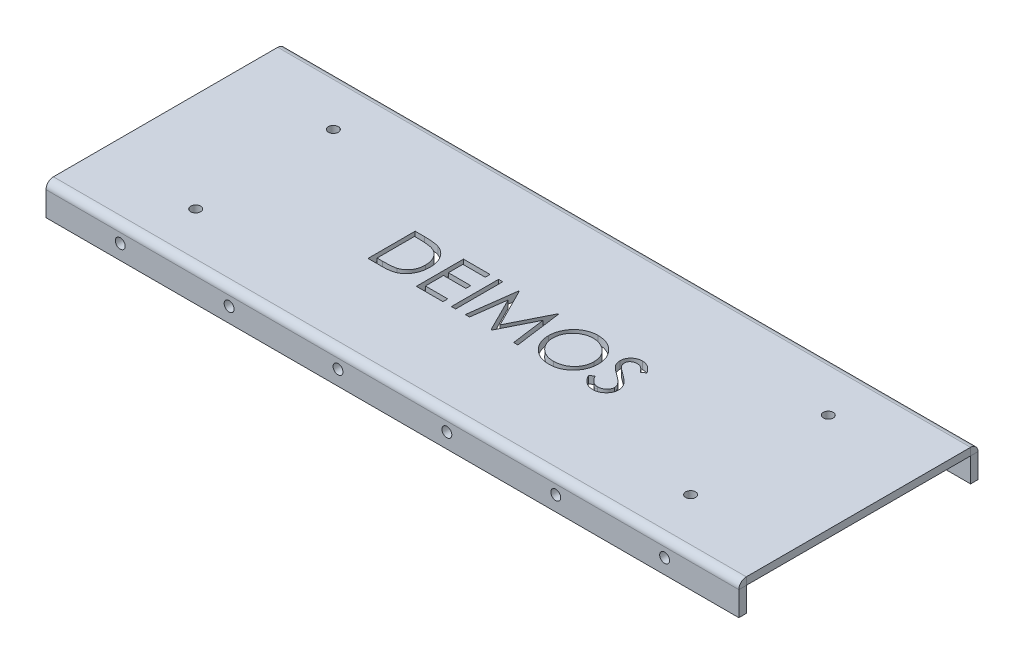
from build123d import *

# Parameters (mm, degrees)
SKETCH1_W                  = 280
SKETCH1_H                  = 115
BOSS_EXTRUDE1_DEPTH        = 3
SKETCH7_R                  = 2
CUT_EXTRUDE1_DEPTH         = 3
SKETCHED_BEND1_OUTLINE_W   = 280
SKETCHED_BEND1_OUTLINE_H   = 102.178097245
SKETCHED_BEND1_OUTLINE_R   = 2
SKETCHED_BEND1_DEPTH       = 3
SKETCHED_START             = 3
SKETCHED_BEND1_2_OUTLINE_W = 280
SKETCHED_BEND1_2_OUTLINE_H = 3
SKETCHED_BEND1_2_DEPTH     = 90.64380551
SKETCHED_START_2           = 93.64380551
SKETCHED_BEND1_3_OUTLINE_W = 280
SKETCHED_BEND1_3_OUTLINE_H = 9.821902755
SKETCHED_BEND1_3_OUTLINE_R = 2
SKETCHED_BEND1_3_DEPTH     = 3
SKETCHED_BEND1_4_DEPTH     = 280
SKETCHED_BEND1_5_DEPTH     = 280
SKETCH8_R                  = 2
SKETCH8_W                  = 1.709615384
SKETCH8_H                  = 19.05
CUT_EXTRUDE2_DEPTH         = 3


with BuildPart() as part:
    # Sketch1 → Boss-Extrude1 (new body)
    with BuildSketch(Plane.XY):
        with Locations((140, -57.5)):
            Rectangle(SKETCH1_W, SKETCH1_H)
    extrude(amount=BOSS_EXTRUDE1_DEPTH)

    # Sketch7 → Cut-Extrude1 (cut)
    with BuildSketch(Plane.XY.offset(3)):
        with Locations((30, -6)):
            Circle(SKETCH7_R)
        with Locations((74, -6)):
            Circle(SKETCH7_R)
        with Locations((118, -6)):
            Circle(SKETCH7_R)
        with Locations((162, -6)):
            Circle(SKETCH7_R)
        with Locations((206, -6)):
            Circle(SKETCH7_R)
        with Locations((250, -6)):
            Circle(SKETCH7_R)
        with Locations(Location((250, -109, 0), (0, 0, 180))):
            Circle(SKETCH7_R)
        with Locations(Location((206, -109, 0), (0, 0, 180))):
            Circle(SKETCH7_R)
        with Locations(Location((162, -109, 0), (0, 0, 180))):
            Circle(SKETCH7_R)
        with Locations(Location((118, -109, 0), (0, 0, 180))):
            Circle(SKETCH7_R)
        with Locations(Location((74, -109, 0), (0, 0, 180))):
            Circle(SKETCH7_R)
        with Locations(Location((30, -109, 0), (0, 0, 180))):
            Circle(SKETCH7_R)
    extrude(amount=-CUT_EXTRUDE1_DEPTH, mode=Mode.SUBTRACT)

    # Sketched Bend1: read off the stored shape, not the designer's step
    # Sketched Bend1 outline → Sketched Bend1 (cut)
    with BuildSketch(Plane.XY):
        with Locations((140, -51.089048623)):
            Rectangle(SKETCHED_BEND1_OUTLINE_W, SKETCHED_BEND1_OUTLINE_H)
        with Locations((30, -6)):
            Circle(SKETCHED_BEND1_OUTLINE_R, mode=Mode.SUBTRACT)
        with Locations((74, -6)):
            Circle(SKETCHED_BEND1_OUTLINE_R, mode=Mode.SUBTRACT)
        with Locations((118, -6)):
            Circle(SKETCHED_BEND1_OUTLINE_R, mode=Mode.SUBTRACT)
        with Locations((162, -6)):
            Circle(SKETCHED_BEND1_OUTLINE_R, mode=Mode.SUBTRACT)
        with Locations((206, -6)):
            Circle(SKETCHED_BEND1_OUTLINE_R, mode=Mode.SUBTRACT)
        with Locations((250, -6)):
            Circle(SKETCHED_BEND1_OUTLINE_R, mode=Mode.SUBTRACT)
    extrude(amount=SKETCHED_BEND1_DEPTH, mode=Mode.SUBTRACT)

    # Sketched Bend1 2 outline → Sketched Bend1 2 (add)
    with BuildSketch(Plane.XY.offset(SKETCHED_START)):
        with Locations((140, -103.678097245)):
            Rectangle(SKETCHED_BEND1_2_OUTLINE_W, SKETCHED_BEND1_2_OUTLINE_H)
    extrude(amount=SKETCHED_BEND1_2_DEPTH)

    # Sketched Bend1 3 outline → Sketched Bend1 3 (add)
    with BuildSketch(Plane.XY.offset(SKETCHED_START_2)):
        with Locations((140, -110.089048623)):
            Rectangle(SKETCHED_BEND1_3_OUTLINE_W, SKETCHED_BEND1_3_OUTLINE_H)
        with Locations((30, -109)):
            Circle(SKETCHED_BEND1_3_OUTLINE_R, mode=Mode.SUBTRACT)
        with Locations((74, -109)):
            Circle(SKETCHED_BEND1_3_OUTLINE_R, mode=Mode.SUBTRACT)
        with Locations((118, -109)):
            Circle(SKETCHED_BEND1_3_OUTLINE_R, mode=Mode.SUBTRACT)
        with Locations((162, -109)):
            Circle(SKETCHED_BEND1_3_OUTLINE_R, mode=Mode.SUBTRACT)
        with Locations((206, -109)):
            Circle(SKETCHED_BEND1_3_OUTLINE_R, mode=Mode.SUBTRACT)
        with Locations((250, -109)):
            Circle(SKETCHED_BEND1_3_OUTLINE_R, mode=Mode.SUBTRACT)
    extrude(amount=SKETCHED_BEND1_3_DEPTH)

    # Sketched Bend1 4 outline → Sketched Bend1 4 (cut)
    with BuildSketch(Plane.YZ):
        with BuildLine():
            Line((-102.178097245, 0), (-102.178097245, 3))
            ThreePointArc((-102.178097245, 3), (-103.056776902, 0.878679656), (-105.178097245, 0))
            Line((-105.178097245, 0), (-102.178097245, 0))
        make_face()
    extrude(amount=SKETCHED_BEND1_4_DEPTH, mode=Mode.SUBTRACT)

    # Sketched Bend1 5 outline → Sketched Bend1 5 (add)
    with BuildSketch(Plane.YZ):
        with BuildLine():
            ThreePointArc((-102.178097245, 93.64380551), (-103.056776902, 95.765125853), (-105.178097245, 96.64380551))
            Line((-105.178097245, 96.64380551), (-105.178097245, 93.64380551))
            Line((-105.178097245, 93.64380551), (-102.178097245, 93.64380551))
        make_face()
    extrude(amount=SKETCHED_BEND1_5_DEPTH)

    # Sketch8 → Cut-Extrude2 (cut)
    # profile 1 of 10: a face of its own
    with BuildSketch(Plane(origin=(0, -102.178097245, 0), x_dir=(1, 0, 0), z_dir=(0, 1, 0))):
        with Locations(Location((40, -20.5, 0), (0, 0, 270))):
            Circle(SKETCH8_R)
    # profile 2 of 10: a face of its own
    with BuildSketch(Plane(origin=(0, -102.178097245, 0), x_dir=(1, 0, 0), z_dir=(0, 1, 0))):
        with Locations(Location((240, -20.5, 0), (0, 0, 90))):
            Circle(SKETCH8_R)
    # profile 3 of 10: a face of its own
    with BuildSketch(Plane(origin=(0, -102.178097245, 0), x_dir=(1, 0, 0), z_dir=(0, 1, 0))):
        with Locations(Location((240, -76.14380551, 0), (0, 0, 270))):
            Circle(SKETCH8_R)
    # profile 4 of 10: a face of its own
    with BuildSketch(Plane(origin=(0, -102.178097245, 0), x_dir=(1, 0, 0), z_dir=(0, 1, 0))):
        with Locations(Location((40, -76.14380551, 0), (0, 0, 90))):
            Circle(SKETCH8_R)
    # profile 5 of 10: a face of its own
    with BuildSketch(Plane(origin=(0, -102.178097245, 0), x_dir=(1, 0, 0), z_dir=(0, 1, 0))):
        with BuildLine():
            Line((92.130769231, -58.64380551), (92.130769231, -39.59380551))
            Line((92.130769231, -39.59380551), (95.977403846, -39.59380551))
            add(Edge.make_bspline(
                [(95.977403846, -39.59380551), (96.311970768, -39.596214355), (96.958352319, -39.600868232), (97.892414354, -39.630376089), (98.75665169, -39.682575625), (99.548221966, -39.75860976), (100.269298277, -39.851971271), (100.917861558, -39.968994901), (101.497265365, -40.107179085), (101.853606177, -40.224992179), (102.022115385, -40.280704548)],
                knots=[0, 0, 0, 0, 1.314313732, 2.53924729, 3.670748893, 4.714932338, 5.66265055, 6.526160246, 7.303039223, 8, 8, 8, 8], degree=3))
            add(Edge.make_bspline(
                [(102.022115385, -40.280704548), (102.242522466, -40.364691675), (102.678338527, -40.530761378), (103.298863008, -40.844032104), (103.883019626, -41.198977701), (104.433940972, -41.596066039), (104.939042613, -42.046540564), (105.418057022, -42.531265559), (105.85138859, -43.067867811), (106.24821803, -43.645218817), (106.606007834, -44.256517272), (106.917008107, -44.900598364), (107.175293414, -45.574191168), (107.389705119, -46.275422473), (107.558686552, -47.005834187), (107.67397678, -47.766276801), (107.750018882, -48.55374496), (107.757660933, -49.088094541), (107.761538462, -49.359220173)],
                knots=[0, 0, 0, 0, 0.984719456, 1.947108742, 2.898477687, 3.838006223, 4.779231079, 5.722358779, 6.681677486, 7.655904652, 8.64651281, 9.637519902, 10.640069247, 11.656948941, 12.698408672, 13.768548281, 14.867775369, 16, 16, 16, 16], degree=3))
            add(Edge.make_bspline(
                [(107.761538462, -49.359220173), (107.758115081, -49.594684914), (107.751368953, -50.05869278), (107.690793677, -50.742538226), (107.602748278, -51.406096378), (107.466436287, -52.046207403), (107.300959749, -52.66847956), (107.08888344, -53.266280776), (106.845938811, -53.845094938), (106.562638758, -54.397095771), (106.251626362, -54.920063841), (105.917860874, -55.413053501), (105.561698289, -55.869030065), (105.179742344, -56.289374368), (104.776928916, -56.67345273), (104.350620774, -57.024473557), (103.899717884, -57.33556852), (103.426239807, -57.618962352), (102.916374018, -57.866178858), (102.360463089, -58.075347911), (101.756136249, -58.248684489), (101.104876855, -58.393306079), (100.40555964, -58.508026827), (99.657498983, -58.584914763), (98.861844221, -58.63691001), (98.31549422, -58.64146238), (98.034284856, -58.64380551)],
                knots=[0, 0, 0, 0, 1.105936401, 2.179363191, 3.223086493, 4.248585256, 5.251745608, 6.245858792, 7.225916811, 8.198733463, 9.158002045, 10.082870192, 10.993790845, 11.873723703, 12.748670949, 13.606408763, 14.465103618, 15.319838547, 16.196477973, 17.123216899, 18.106603292, 19.147568657, 20.255746949, 21.433717677, 22.679120308, 24, 24, 24, 24], degree=3))
            Line((98.034284856, -58.64380551), (92.130769231, -58.64380551))
        make_face()
        with BuildLine():
            Line((93.840384615, -56.689959356), (96.027013221, -56.689959356))
            add(Edge.make_bspline(
                [(96.027013221, -56.689959356), (96.341220496, -56.688609003), (96.945556156, -56.686011779), (97.814551827, -56.663221431), (98.608552542, -56.625981742), (99.327671043, -56.573865962), (99.971501304, -56.504912499), (100.541388857, -56.428032671), (101.03546562, -56.332252261), (101.334438698, -56.245433467), (101.472596154, -56.205313923)],
                knots=[0, 0, 0, 0, 1.375205317, 2.645023457, 3.804390687, 4.853969522, 5.800190428, 6.637939096, 7.370582563, 8, 8, 8, 8], degree=3))
            add(Edge.make_bspline(
                [(101.472596154, -56.205313923), (101.646486525, -56.144073299), (101.990113898, -56.023054782), (102.484766662, -55.802305226), (102.94608693, -55.540819103), (103.382114353, -55.250158155), (103.786663721, -54.92007063), (104.164529268, -54.557734248), (104.514950216, -54.161304972), (104.834306092, -53.731274836), (105.12010129, -53.270320377), (105.367594695, -52.782973296), (105.584500889, -52.274573372), (105.7547458, -51.737313523), (105.888180622, -51.17599679), (105.982694138, -50.590583687), (106.041557139, -49.981183538), (106.04842302, -49.566698405), (106.051923077, -49.355404068)],
                knots=[0, 0, 0, 0, 0.998632004, 1.973411704, 2.929992603, 3.868527914, 4.809262121, 5.754881198, 6.702106254, 7.672490631, 8.653608572, 9.636854334, 10.631411391, 11.644891563, 12.686317036, 13.754757253, 14.855430412, 16, 16, 16, 16], degree=3))
            add(Edge.make_bspline(
                [(106.051923077, -49.355404068), (106.049129327, -49.132608982), (106.043640981, -48.694926064), (105.97465652, -48.052719566), (105.873846339, -47.435060596), (105.728066562, -46.841907847), (105.542297065, -46.272104102), (105.310460515, -45.728800768), (105.045575058, -45.206259981), (104.730415468, -44.716542362), (104.385253452, -44.253392725), (104.002196709, -43.829095256), (103.587331042, -43.442683422), (103.145181362, -43.088139449), (102.663286579, -42.779727156), (102.152998633, -42.503846791), (101.60683148, -42.26971744), (101.22685095, -42.145191058), (101.03374399, -42.081906471)],
                knots=[0, 0, 0, 0, 1.122418816, 2.205001699, 3.251619955, 4.274784885, 5.280384055, 6.268708349, 7.249350384, 8.229342522, 9.199999885, 10.157847722, 11.105861043, 12.055065948, 13.010012805, 13.98527497, 14.976112212, 16, 16, 16, 16], degree=3))
            add(Edge.make_bspline(
                [(101.03374399, -42.081906471), (100.873989894, -42.037729914), (100.534308852, -41.943798432), (99.980011198, -41.841334619), (99.356177313, -41.750958703), (98.660037512, -41.674442803), (97.892385327, -41.619538954), (97.052630368, -41.57832937), (96.140409663, -41.550534699), (95.508044729, -41.548636735), (95.17983774, -41.547651664)],
                knots=[0, 0, 0, 0, 0.674548936, 1.434276114, 2.292660221, 3.240891867, 4.284742987, 5.42552168, 6.663806718, 8, 8, 8, 8], degree=3))
            Line((95.17983774, -41.547651664), (93.840384615, -41.547651664))
            Line((93.840384615, -41.547651664), (93.840384615, -56.689959356))
        make_face(mode=Mode.SUBTRACT)
    # profile 6 of 10: a face of its own
    with BuildSketch(Plane(origin=(0, -102.178097245, 0), x_dir=(1, 0, 0), z_dir=(0, 1, 0))):
        Polygon((111.669230769, -39.59380551), (122.415384615, -39.59380551), (122.415384615, -41.547651664), (113.378846154, -41.547651664), (113.378846154, -47.409190125), (122.415384615, -47.409190125), (122.415384615, -49.363036279), (113.378846154, -49.363036279), (113.378846154, -56.689959356), (122.415384615, -56.689959356), (122.415384615, -58.64380551), (111.669230769, -58.64380551), align=None)
    # profile 7 of 10: a face of its own
    with BuildSketch(Plane(origin=(0, -102.178097245, 0), x_dir=(1, 0, 0), z_dir=(0, 1, 0))):
        with Locations((126.689423077, -49.11880551)):
            Rectangle(SKETCH8_W, SKETCH8_H)
    # profile 8 of 10: a face of its own
    with BuildSketch(Plane(origin=(0, -102.178097245, 0), x_dir=(1, 0, 0), z_dir=(0, 1, 0))):
        Polygon((131.451923077, -58.64380551), (133.966736779, -39.59380551), (134.210967548, -39.59380551), (142.075961538, -55.224574741), (149.918058894, -39.59380551), (150.162289663, -39.59380551), (152.7, -58.64380551), (150.990384615, -58.64380551), (149.158653846, -44.947801904), (142.285847356, -58.64380551), (141.896604567, -58.64380551), (134.993269231, -44.905824741), (133.172986779, -58.64380551), align=None)
    # profile 9 of 10: a face of its own
    with BuildSketch(Plane(origin=(0, -102.178097245, 0), x_dir=(1, 0, 0), z_dir=(0, 1, 0))):
        with BuildLine():
            add(Edge.make_bspline(
                [(165.522115385, -39.105343971), (165.874856647, -39.114278309), (166.567669588, -39.131826085), (167.585891532, -39.266150921), (168.557959122, -39.498535829), (169.491790877, -39.808032919), (170.376216935, -40.220897502), (171.217894336, -40.719926667), (172.014820463, -41.310348535), (172.756253983, -41.987599041), (173.434743955, -42.724471841), (174.032510565, -43.510844465), (174.533483621, -44.341962232), (174.944886262, -45.21532761), (175.267640124, -46.128965436), (175.490356633, -47.087746508), (175.63262285, -48.085458636), (175.64925501, -48.765961999), (175.657692308, -49.111173298)],
                knots=[0, 0, 0, 0, 1.065120563, 2.091984664, 3.0946048, 4.079830382, 5.057816894, 6.036188127, 7.030412546, 8.04752943, 9.064399622, 10.05169764, 11.02544977, 11.989514704, 12.962713494, 13.945757189, 14.957906945, 16, 16, 16, 16], degree=3))
            add(Edge.make_bspline(
                [(175.657692308, -49.111173298), (175.649256246, -49.453841685), (175.632627792, -50.129280773), (175.490194874, -51.120661519), (175.266814575, -52.073655167), (174.947883469, -52.986670792), (174.538441936, -53.860671532), (174.034133076, -54.693357666), (173.440093057, -55.485002179), (172.764052911, -56.226932543), (172.027084382, -56.907275919), (171.236616787, -57.500105799), (170.410427432, -58.01023282), (169.537884592, -58.417269674), (168.630560106, -58.742599698), (167.680333461, -58.964410442), (166.691657217, -59.107487063), (166.017445039, -59.123916414), (165.674759615, -59.132267048)],
                knots=[0, 0, 0, 0, 1.043624062, 2.057103931, 3.04512605, 4.022047818, 4.998200453, 5.980619268, 6.982898556, 8.009068085, 9.034988726, 10.034168286, 11.015286542, 11.987931943, 12.962482838, 13.94673481, 14.956375938, 16, 16, 16, 16], degree=3))
            add(Edge.make_bspline(
                [(165.674759615, -59.132267048), (165.329550108, -59.123833957), (164.649050275, -59.107210089), (163.650084411, -58.964708443), (162.690629834, -58.741870775), (161.773430294, -58.423412272), (160.89797432, -58.011838488), (160.062549727, -57.509983225), (159.270509797, -56.914495785), (158.528421148, -56.238674858), (157.849429084, -55.50295541), (157.257467339, -54.71464325), (156.755499222, -53.889204265), (156.34530737, -53.024347741), (156.020562241, -52.124254603), (155.799011731, -51.182920747), (155.655668906, -50.205712865), (155.63915067, -49.540362233), (155.630769231, -49.202759837)],
                knots=[0, 0, 0, 0, 1.053102029, 2.075944431, 3.073151272, 4.055350789, 5.033113405, 6.020478099, 7.024410459, 8.052272461, 9.079885166, 10.07527673, 11.055994387, 12.023226415, 12.992069828, 13.970394897, 14.97016774, 16, 16, 16, 16], degree=3))
            add(Edge.make_bspline(
                [(155.630769231, -49.202759837), (155.633679175, -48.976159166), (155.639462355, -48.525816494), (155.709085709, -47.857071142), (155.810114397, -47.199080562), (155.954904807, -46.55371583), (156.14427088, -45.922556757), (156.367711201, -45.301250462), (156.640615216, -44.696093337), (156.949119886, -44.10421859), (157.29344487, -43.534852703), (157.673768592, -42.996665258), (158.076732526, -42.485140118), (158.518493283, -42.013532854), (158.984491363, -41.568123953), (159.48228625, -41.155758307), (160.008840465, -40.772717503), (160.566419704, -40.427529646), (161.141284886, -40.115332071), (161.733885633, -39.847424568), (162.336173544, -39.61748529), (162.950969556, -39.43111737), (163.576641073, -39.28398586), (164.214553643, -39.183797263), (164.864199063, -39.113996333), (165.301866385, -39.108240501), (165.522115385, -39.105343971)],
                knots=[0, 0, 0, 0, 1.037015668, 2.060948919, 3.074880161, 4.083647147, 5.086022904, 6.090072063, 7.104153813, 8.122640571, 9.144368836, 10.147691507, 11.138137339, 12.123020368, 13.103399296, 14.087645067, 15.080126199, 16.082011238, 17.087798457, 18.072939717, 19.057185487, 20.037253025, 21.01195951, 21.997135196, 22.992090687, 24, 24, 24, 24], degree=3))
        make_face()
        with BuildLine():
            add(Edge.make_bspline(
                [(165.606069712, -41.059190125), (165.425287206, -41.061393885), (165.065450488, -41.065780337), (164.530501798, -41.12356016), (164.002588558, -41.205909984), (163.481601744, -41.323375119), (162.969721226, -41.483417177), (162.462175662, -41.667608406), (161.963593326, -41.891968913), (161.475620185, -42.14545749), (161.002553848, -42.426030902), (160.55617043, -42.736120091), (160.135314325, -43.068453079), (159.741015974, -43.423805451), (159.374433165, -43.803986855), (159.028350719, -44.203233686), (158.716640567, -44.63295755), (158.43096907, -45.081505622), (158.175329825, -45.548293657), (157.948006966, -46.028407336), (157.762057147, -46.525763031), (157.610406213, -47.034964946), (157.484677243, -47.555206619), (157.405026884, -48.090434596), (157.346612185, -48.63795942), (157.342476455, -49.00797494), (157.340384615, -49.195127625)],
                knots=[0, 0, 0, 0, 1.008559885, 2.007477868, 2.99961109, 3.989939068, 4.984837346, 5.991145699, 7.001802488, 8.033829008, 9.059044045, 10.069351652, 11.065060232, 12.050310815, 13.029377138, 14.011219647, 14.996725999, 15.989392538, 16.977580475, 17.965360261, 18.951710183, 19.937753436, 20.929683414, 21.935841486, 22.955955122, 24, 24, 24, 24], degree=3))
            add(Edge.make_bspline(
                [(157.340384615, -49.195127625), (157.347323507, -49.47033057), (157.360974453, -50.011739899), (157.48048637, -50.805135082), (157.664574546, -51.567615612), (157.935941069, -52.295009433), (158.275306557, -52.993569029), (158.694552917, -53.657097427), (159.191263083, -54.285773958), (159.755488849, -54.875209636), (160.372288152, -55.413213228), (161.027242011, -55.885454066), (161.713333789, -56.285015569), (162.432352649, -56.610526034), (163.180459969, -56.868461607), (163.962476354, -57.045238157), (164.773192426, -57.161581707), (165.325809278, -57.172754564), (165.606069712, -57.178420894)],
                knots=[0, 0, 0, 0, 1.032063989, 2.030389145, 3.003944642, 3.970395727, 4.937377036, 5.913328081, 6.909231446, 7.93887556, 8.970685674, 9.976071282, 10.964166581, 11.944589148, 12.933237628, 13.927779006, 14.949070134, 16, 16, 16, 16], degree=3))
            add(Edge.make_bspline(
                [(165.606069712, -57.178420894), (165.794444285, -57.175832792), (166.16804764, -57.170699808), (166.723738983, -57.118999867), (167.269419221, -57.036094978), (167.804322973, -56.916729552), (168.327843161, -56.767338328), (168.842164875, -56.589859123), (169.341809855, -56.368437143), (169.833081258, -56.123791864), (170.303323659, -55.844899007), (170.752226199, -55.545334221), (171.168474032, -55.213490728), (171.562477407, -54.863418062), (171.930565257, -54.488057691), (172.270248442, -54.087897626), (172.580383162, -53.660412049), (172.865946181, -53.21254434), (173.120689654, -52.744479022), (173.342644464, -52.262624632), (173.530946181, -51.76816768), (173.682957043, -51.260394984), (173.802076484, -50.740270935), (173.884154334, -50.20709911), (173.941567979, -49.661946117), (173.94589547, -49.293225987), (173.948076923, -49.107357193)],
                knots=[0, 0, 0, 0, 1.047197238, 2.076906641, 3.100256066, 4.114471768, 5.12198147, 6.126382909, 7.136867548, 8.15857795, 9.17633901, 10.174870724, 11.156907918, 12.133735059, 13.104061851, 14.077631395, 15.04955518, 16.038496417, 17.029181396, 18.010275684, 18.986308667, 19.968651475, 20.955262928, 21.950658345, 22.966943676, 24, 24, 24, 24], degree=3))
            add(Edge.make_bspline(
                [(173.948076923, -49.107357193), (173.945893722, -48.922759948), (173.941562942, -48.556577309), (173.884181759, -48.015226283), (173.801989769, -47.485890947), (173.683538459, -46.97064939), (173.530865479, -46.469370275), (173.342611581, -45.982524406), (173.120623022, -45.508298087), (172.865852544, -45.047863413), (172.579472133, -44.606040911), (172.26653918, -44.183662065), (171.921650642, -43.788659002), (171.554660421, -43.411280167), (171.156401746, -43.059574225), (170.728678659, -42.733424506), (170.276683784, -42.42495997), (169.798108403, -42.14669084), (169.304202026, -41.889710517), (168.797396055, -41.669541485), (168.283431956, -41.48245895), (167.763616716, -41.322890897), (167.233575077, -41.206370047), (166.696888522, -41.123485947), (166.154299572, -41.065800447), (165.789392905, -41.061400558), (165.606069712, -41.059190125)],
                knots=[0, 0, 0, 0, 1.02996197, 2.043119294, 3.035359645, 4.018872909, 4.991431989, 5.957985074, 6.929999688, 7.912076566, 8.892894881, 9.867085534, 10.843653904, 11.817741046, 12.803660682, 13.806313499, 14.818574707, 15.856120519, 16.894564902, 17.924820532, 18.937903209, 19.946497019, 20.957711757, 21.963978472, 22.977135795, 24, 24, 24, 24], degree=3))
        make_face(mode=Mode.SUBTRACT)
    # profile 10 of 10: a face of its own
    with BuildSketch(Plane(origin=(0, -102.178097245, 0), x_dir=(1, 0, 0), z_dir=(0, 1, 0))):
        with BuildLine():
            Line((177.611538462, -54.968895654), (179.221935096, -54.003420894))
            add(Edge.make_bspline(
                [(179.221935096, -54.003420894), (179.37171293, -54.254142761), (179.658681481, -54.734516182), (180.137388164, -55.383620659), (180.63341158, -55.935320398), (181.150424953, -56.386405934), (181.685272471, -56.741546303), (182.241445677, -56.99301845), (182.817070333, -57.149859687), (183.208813561, -57.168910158), (183.404387019, -57.178420894)],
                knots=[0, 0, 0, 0, 1.272034388, 2.437168799, 3.508375237, 4.49857839, 5.41946034, 6.295179144, 7.148887113, 8, 8, 8, 8], degree=3))
            add(Edge.make_bspline(
                [(183.404387019, -57.178420894), (183.571411217, -57.173769034), (183.902537082, -57.16454671), (184.390011576, -57.07593263), (184.863441099, -56.939795186), (185.313068113, -56.744826973), (185.73268853, -56.508941786), (186.100662114, -56.22402902), (186.418775959, -55.905043815), (186.67899414, -55.549175366), (186.878638332, -55.166449171), (187.032083733, -54.773605779), (187.117237633, -54.364474), (187.130065106, -54.089008481), (187.136538462, -53.949995414)],
                knots=[0, 0, 0, 0, 1.095163259, 2.171163733, 3.241058638, 4.321873601, 5.38011039, 6.391990106, 7.366004449, 8.327778327, 9.272591725, 10.192022065, 11.087607919, 12, 12, 12, 12], degree=3))
            add(Edge.make_bspline(
                [(187.136538462, -53.949995414), (187.128513999, -53.791385932), (187.112201439, -53.468956032), (186.974325812, -52.993252207), (186.757432054, -52.522485504), (186.557338236, -52.231285759), (186.453455529, -52.080103587)],
                knots=[0, 0, 0, 0, 0.938893495, 1.908633276, 2.914225137, 4, 4, 4, 4], degree=3))
            add(Edge.make_bspline(
                [(186.453455529, -52.080103587), (186.368162615, -51.97099159), (186.18910081, -51.7419246), (185.881266348, -51.400955533), (185.520045069, -51.04924671), (185.117798577, -50.673368128), (184.659874194, -50.290801692), (184.160614437, -49.883304351), (183.607272576, -49.46637291), (183.219199602, -49.186759375), (183.018960337, -49.042483394)],
                knots=[0, 0, 0, 0, 0.722233717, 1.516239348, 2.393582979, 3.351407094, 4.387010283, 5.505090956, 6.712668013, 8, 8, 8, 8], degree=3))
            add(Edge.make_bspline(
                [(183.018960337, -49.042483394), (182.818532586, -48.899724939), (182.435329989, -48.626781643), (181.899433991, -48.221700897), (181.420220557, -47.851347836), (180.999819624, -47.512235999), (180.638416104, -47.204319393), (180.33316211, -46.930554895), (180.091833677, -46.683538657), (179.957636874, -46.52329364), (179.897385817, -46.451347577)],
                knots=[0, 0, 0, 0, 1.452282411, 2.77665338, 3.964542531, 5.026858415, 5.96415736, 6.766646006, 7.446254459, 8, 8, 8, 8], degree=3))
            add(Edge.make_bspline(
                [(179.897385817, -46.451347577), (179.813170964, -46.339219077), (179.647551153, -46.118703332), (179.428933323, -45.774035177), (179.243118737, -45.421211404), (179.097455186, -45.059283913), (178.974793767, -44.6933338), (178.892291315, -44.318586305), (178.840630998, -43.936722968), (178.835340614, -43.679746629), (178.832692308, -43.551107193)],
                knots=[0, 0, 0, 0, 1.068054152, 2.10047183, 3.106115577, 4.101338837, 5.06977816, 6.043150881, 7.020423561, 8, 8, 8, 8], degree=3))
            add(Edge.make_bspline(
                [(178.832692308, -43.551107193), (178.839796374, -43.34955942), (178.853852662, -42.950771815), (178.972727477, -42.368218295), (179.160358512, -41.812032225), (179.423220688, -41.28771998), (179.762078566, -40.808933712), (180.154214512, -40.370166019), (180.621274173, -40.001311307), (181.133733451, -39.679028532), (181.694654562, -39.426774282), (182.282433622, -39.236486661), (182.898004828, -39.128667702), (183.314944746, -39.113194938), (183.526502404, -39.105343971)],
                knots=[0, 0, 0, 0, 1.005424448, 1.989358655, 2.955360095, 3.929531133, 4.905563448, 5.876582895, 6.856512386, 7.866279853, 8.892233794, 9.918561126, 10.94386622, 12, 12, 12, 12], degree=3))
            add(Edge.make_bspline(
                [(183.526502404, -39.105343971), (183.75098815, -39.113086716), (184.19741865, -39.128484565), (184.854095095, -39.262365414), (185.48634128, -39.483893357), (185.994939621, -39.735291624), (186.392990794, -39.986378329), (186.696553811, -40.21508623), (187.004170221, -40.478385035), (187.318321348, -40.776976075), (187.63368408, -41.113599105), (187.954940299, -41.485948712), (188.282841248, -41.891749395), (188.493783858, -42.181442749), (188.601923077, -42.329953346)],
                knots=[0, 0, 0, 0, 1.286793592, 2.559021753, 3.825965368, 5.121522368, 5.803751409, 6.523245864, 7.299691795, 8.125521123, 9.008227632, 9.944561021, 10.946284179, 12, 12, 12, 12], degree=3))
            Line((188.601923077, -42.329953346), (187.05640024, -43.501497818))
            add(Edge.make_bspline(
                [(187.05640024, -43.501497818), (186.963077379, -43.381272231), (186.783359369, -43.149745861), (186.510511733, -42.825507701), (186.253344092, -42.529326576), (185.999976916, -42.272069237), (185.763791579, -42.039647625), (185.534554535, -41.840658092), (185.315564709, -41.673150922), (185.03951981, -41.494388117), (184.692713371, -41.317187719), (184.257368967, -41.167242023), (183.802420813, -41.077135186), (183.492560961, -41.065221384), (183.335697115, -41.059190125)],
                knots=[0, 0, 0, 0, 1.181633172, 2.275549214, 3.290209073, 4.226197932, 5.078386478, 5.862611352, 6.581680152, 7.217281963, 8.414376989, 9.595101626, 10.782541182, 12, 12, 12, 12], degree=3))
            add(Edge.make_bspline(
                [(183.335697115, -41.059190125), (183.138902329, -41.065785235), (182.759402123, -41.078503283), (182.220612409, -41.217404917), (181.735686902, -41.436109042), (181.319022227, -41.742623423), (180.972110966, -42.105776255), (180.721165541, -42.523672595), (180.570125359, -42.9851311), (180.551694323, -43.307030687), (180.542307692, -43.470968971)],
                knots=[0, 0, 0, 0, 1.14458467, 2.207223713, 3.21896685, 4.227309161, 5.202851033, 6.127160689, 7.046193047, 8, 8, 8, 8], degree=3))
            add(Edge.make_bspline(
                [(180.542307692, -43.470968971), (180.544447424, -43.57303059), (180.548730388, -43.777320719), (180.608464644, -44.079134887), (180.685205277, -44.380186606), (180.80681303, -44.679122378), (180.974699611, -44.981170247), (181.195163497, -45.291531418), (181.472821667, -45.612941433), (181.685512262, -45.821987281), (181.79780649, -45.932357193)],
                knots=[0, 0, 0, 0, 0.858281714, 1.717966888, 2.583508476, 3.4729293, 4.427298488, 5.488583878, 6.674047936, 8, 8, 8, 8], degree=3))
            add(Edge.make_bspline(
                [(181.79780649, -45.932357193), (181.839506246, -45.969570147), (181.93857532, -46.05797961), (182.11969143, -46.202717594), (182.358865803, -46.381258398), (182.649852927, -46.602169363), (182.998018138, -46.858427036), (183.403399723, -47.146754839), (183.861478923, -47.476512837), (184.186536779, -47.70705888), (184.358413462, -47.82896176)],
                knots=[0, 0, 0, 0, 0.420754252, 0.999615792, 1.744751191, 2.668019286, 3.750313428, 4.999500688, 6.413464383, 8, 8, 8, 8], degree=3))
            add(Edge.make_bspline(
                [(184.358413462, -47.82896176), (184.565165361, -47.979409731), (184.965511759, -48.270731376), (185.535148016, -48.708422434), (186.051641457, -49.136491003), (186.516805465, -49.552203407), (186.935235495, -49.952406314), (187.302289375, -50.341914481), (187.621707149, -50.717937384), (187.96558261, -51.20002526), (188.316961599, -51.792105161), (188.618721804, -52.517519574), (188.808995095, -53.245753833), (188.8338772, -53.735212757), (188.846153846, -53.976708154)],
                knots=[0, 0, 0, 0, 1.163667725, 2.253281268, 3.268753668, 4.215851969, 5.092017293, 5.902905408, 6.650798638, 7.335211899, 8.59617414, 9.77448103, 10.901945474, 12, 12, 12, 12], degree=3))
            add(Edge.make_bspline(
                [(188.846153846, -53.976708154), (188.842577137, -54.147496113), (188.835493177, -54.485755443), (188.75406306, -54.98244379), (188.634757454, -55.464848952), (188.454940509, -55.927008007), (188.235467319, -56.37737593), (187.956976742, -56.804138931), (187.634173486, -57.216742329), (187.263875423, -57.604183903), (186.858677012, -57.959853912), (186.430412902, -58.27624209), (185.978382131, -58.54004825), (185.505036893, -58.755317833), (185.01026846, -58.92368455), (184.494243237, -59.045674595), (183.956110612, -59.120544964), (183.59034799, -59.128316066), (183.404387019, -59.132267048)],
                knots=[0, 0, 0, 0, 0.983748083, 1.948392443, 2.894712957, 3.844097841, 4.80183111, 5.778335162, 6.776009319, 7.81870978, 8.863265674, 9.881300176, 10.883814829, 11.87499822, 12.874611388, 13.892143829, 14.928324115, 16, 16, 16, 16], degree=3))
            add(Edge.make_bspline(
                [(183.404387019, -59.132267048), (183.260503224, -59.12948476), (182.974547701, -59.123955223), (182.551586093, -59.075071397), (182.137169186, -59.005908447), (181.736497165, -58.896103866), (181.344407825, -58.762879177), (180.962606448, -58.598840538), (180.590907998, -58.40225977), (180.22722944, -58.177496851), (179.872495718, -57.915925412), (179.530034043, -57.611269667), (179.188608047, -57.27193199), (178.858295219, -56.888697352), (178.532414247, -56.467757216), (178.217390333, -56.005173232), (177.906702698, -55.503465064), (177.711764223, -55.150413668), (177.611538462, -54.968895654)],
                knots=[0, 0, 0, 0, 0.915332311, 1.819136955, 2.706846663, 3.586547465, 4.459518054, 5.340707479, 6.227863349, 7.133153174, 8.059268498, 9.028702269, 10.047606654, 11.120612155, 12.245963614, 13.433783089, 14.680604001, 16, 16, 16, 16], degree=3))
        make_face()
    extrude(amount=-CUT_EXTRUDE2_DEPTH, mode=Mode.SUBTRACT)


with BuildPart() as cut_extrude2_piece_1:
    # of the separate pieces the step leaves, piece 1, a body of its own (cut_extrude2_pieces)
    add(part.part.solids().sort_by_distance((0, -115, 0))[0])


with BuildPart() as cut_extrude2_piece_2:
    # of the separate pieces the step leaves, piece 2, a body of its own (cut_extrude2_pieces)
    add(part.part.solids().sort_by_distance((173.948076923, -105.178097245, 49.107357192))[0])


with BuildPart() as cut_extrude2_piece_3:
    # of the separate pieces the step leaves, piece 3, a body of its own (cut_extrude2_pieces)
    add(part.part.solids().sort_by_distance((93.840384615, -105.178097245, 41.547651664))[0])


solid = Compound([cut_extrude2_piece_1.part, cut_extrude2_piece_2.part, cut_extrude2_piece_3.part])
